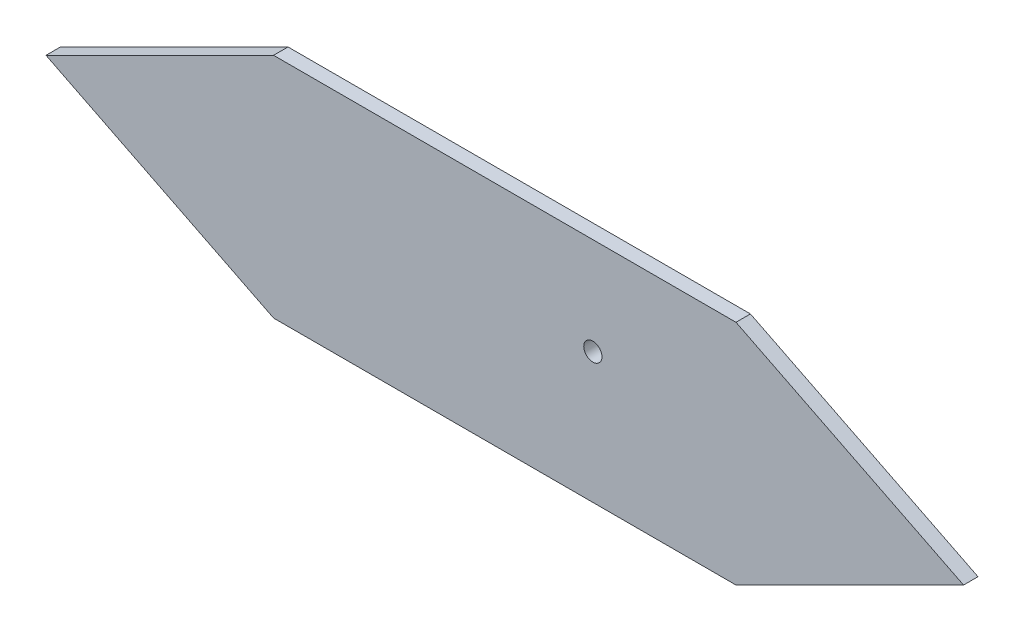
from build123d import *

# Parameters (mm, degrees)
BOSS_EXTRUDE1_DEPTH = 6.35
BOSS_EXTRUDE3_DEPTH = 25
SKETCH3_R           = 4
CUT_EXTRUDE1_DEPTH  = 25


with BuildPart() as part:
    # Sketch1 → Boss-Extrude1 (new body)
    with BuildSketch(Plane.XY):
        Polygon((203.2, 100), (0, 100), (-100, 50), (0, 0), (203.2, 0), (303.2, 50), align=None)
    extrude(amount=BOSS_EXTRUDE1_DEPTH)

    # Sketch2 → Boss-Extrude3 (add)
    with BuildSketch(Plane(origin=(0, 0, 0), x_dir=(-1, 0, 0), z_dir=(0, 0, -1))):
        Polygon((-177.8, 12.7), (-203.2, 12.7), (-203.2, 19.05), (-177.8, 19.05), (-177.8, 25.05), (-209.2, 25.05), (-209.2, 6.7), (-177.8, 6.7), align=None)
        Polygon((6, 6.7), (6, 25.05), (-25.4, 25.05), (-25.4, 19.05), (0, 19.05), (0, 12.7), (-25.4, 12.7), (-25.4, 6.7), align=None)
    extrude(amount=BOSS_EXTRUDE3_DEPTH)

    # Sketch3 → Cut-Extrude1 (cut)
    with BuildSketch(Plane(origin=(0, 0, 0), x_dir=(-1, 0, 0), z_dir=(0, 0, -1))):
        with Locations((-140.3, 57.4)):
            Circle(SKETCH3_R)
    extrude(amount=-CUT_EXTRUDE1_DEPTH, mode=Mode.SUBTRACT)


solid = part.part
